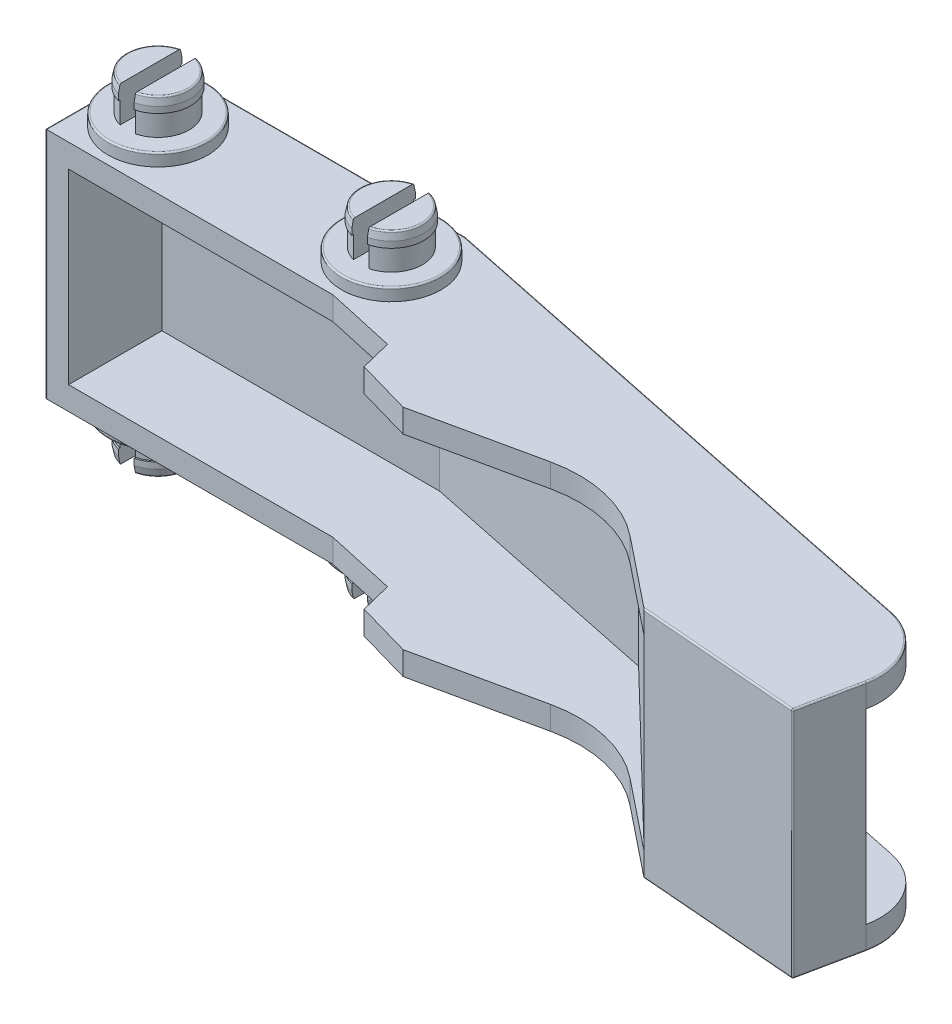
from build123d import *

# Parameters (mm, degrees)
EXTRUDE_1_DEPTH        = 15
FILLET_1_R             = 4
FILLET_2_R             = 8
CUT_EXTRUDE_1_DEPTH    = 13.5
EXTRUDE_2_DEPTH        = 1.5
SKETCH_3_R             = 3.2
EXTRUDE_3_DEPTH        = 0.8
SKETCH_4_R             = 2
EXTRUDE_4_DEPTH        = 2.3
SKETCH_6_W             = 1
SKETCH_6_H             = 6
CUT_EXTRUDE_2_DEPTH    = 2.3
FILLET_3_R             = 0.1
FILLET_3_OF_MIRROR_1_R = 0.1
FILLET_5_R             = 0.1
EXTRUDE_5_DEPTH        = 12


# Read off the part's stored shape, not the designer's step: 镜向2
with BuildPart() as part:
    # 草图1 → 凸台-拉伸1 (new body)
    with BuildSketch(Plane(origin=(0, 0, 0), x_dir=(1, 0, 0), z_dir=(0, 1, 0))):
        Polygon((0, 0), (0, 3.75), (19.5, 3.75), (58, -4.25), (56.372428345, -12.082688588), (46, -11.25), (38.5, -5.25), (27, -7.75), (23.5, -6.75), (23, -4.75), (18.5, -3.75), (0, -3.75), align=None)
    extrude(amount=EXTRUDE_1_DEPTH)

    # 圆角1
    fillet_1_edges = [part.edges().sort_by_distance(p)[0] for p in [
        (58, 7.5, 4.25),
    ]]
    fillet(fillet_1_edges, radius=FILLET_1_R)

    # 圆角2
    fillet_2_edges = [part.edges().sort_by_distance(p)[0] for p in [
        (38.5, 7.5, 5.25),
    ]]
    fillet(fillet_2_edges, radius=FILLET_2_R)

    # 草图2 → 切除-拉伸1 (cut)
    with BuildSketch(Plane(origin=(0, 15, 0), x_dir=(1, 0, 0), z_dir=(0, 1, 0))):
        with BuildLine():
            Line((54.083655706, -3.436214173), (36.230804378, 0.27346922))
            Line((36.230804378, 0.27346922), (46.655708254, -9.797813849))
            Line((46.655708254, -9.797813849), (56.679988889, -10.602553472))
            Line((56.679988889, -10.602553472), (57.186214173, -8.166344294))
            ThreePointArc((57.186214173, -8.166344294), (56.614576963, -5.158718336), (54.083655706, -3.436214173))
        make_face()
        with BuildLine():
            Line((19.345802722, 2.25), (1.5, 2.25))
            Line((1.5, 2.25), (1.5, -3.75))
            Line((1.5, -3.75), (18.5, -3.75))
            Line((18.5, -3.75), (23, -4.75))
            Line((23, -4.75), (23.5, -6.75))
            Line((23.5, -6.75), (27, -7.75))
            Line((27, -7.75), (34.777599803, -6.059217434))
            ThreePointArc((34.777599803, -6.059217434), (38.30350642, -6.087917971), (41.474597338, -7.62967787))
            Line((41.474597338, -7.62967787), (46, -11.25))
            Line((46, -11.25), (35.500722934, -1.106866538))
            Line((35.500722934, -1.106866538), (19.345802722, 2.25))
        make_face()
    extrude(amount=-CUT_EXTRUDE_1_DEPTH, mode=Mode.SUBTRACT)

    # 草图2<2> → 凸台-拉伸2 (add)
    with BuildSketch(Plane(origin=(0, 15, 0), x_dir=(1, 0, 0), z_dir=(0, 1, 0))):
        with BuildLine():
            Line((54.083655706, -3.436214173), (36.230804378, 0.27346922))
            Line((36.230804378, 0.27346922), (46.655708254, -9.797813849))
            Line((46.655708254, -9.797813849), (56.679988889, -10.602553472))
            Line((56.679988889, -10.602553472), (57.186214173, -8.166344294))
            ThreePointArc((57.186214173, -8.166344294), (56.614576963, -5.158718336), (54.083655706, -3.436214173))
        make_face()
        with BuildLine():
            Line((19.345802722, 2.25), (1.5, 2.25))
            Line((1.5, 2.25), (1.5, -3.75))
            Line((1.5, -3.75), (18.5, -3.75))
            Line((18.5, -3.75), (23, -4.75))
            Line((23, -4.75), (23.5, -6.75))
            Line((23.5, -6.75), (27, -7.75))
            Line((27, -7.75), (34.777599803, -6.059217434))
            ThreePointArc((34.777599803, -6.059217434), (38.30350642, -6.087917971), (41.474597338, -7.62967787))
            Line((41.474597338, -7.62967787), (46, -11.25))
            Line((46, -11.25), (35.500722934, -1.106866538))
            Line((35.500722934, -1.106866538), (19.345802722, 2.25))
        make_face()
    extrude(amount=-EXTRUDE_2_DEPTH)

    # 草图3 → 凸台-拉伸3 (add)
    with BuildSketch(Plane(origin=(0, 15, 0), x_dir=(1, 0, 0), z_dir=(0, 1, 0))):
        with Locations(Location((3.5, 0, 0), (0, 0, 270))):
            Circle(SKETCH_3_R)
    extrude_3 = extrude(amount=EXTRUDE_3_DEPTH)

    # 草图4 → 凸台-拉伸4 (add)
    with BuildSketch(Plane(origin=(0, 15.8, 0), x_dir=(1, 0, 0), z_dir=(0, 1, 0))):
        with Locations(Location((3.5, 0, 0), (0, 0, 270))):
            Circle(SKETCH_4_R)
    extrude_4 = extrude(amount=EXTRUDE_4_DEPTH)

    # 草图5 → 旋转1 (revolve)
    with BuildSketch(Plane.XY):
        Polygon((1.5, 18.1), (1.5, 17.2), (1.4, 17.2), (1.4, 17.6), align=None)
    revolve_1 = revolve(axis=Axis((3.5, 18.1, 0), (0, -1, 0)))

    # 草图6 → 切除-拉伸2 (cut)
    with BuildSketch(Plane(origin=(0, 18.1, 0), x_dir=(1, 0, 0), z_dir=(0, 1, 0))):
        with Locations((3.5, 0)):
            Rectangle(SKETCH_6_W, SKETCH_6_H)
    cut_extrude_2 = extrude(amount=-CUT_EXTRUDE_2_DEPTH, mode=Mode.SUBTRACT)

    # 圆角3
    fillet_3_edges = [part.edges().sort_by_distance(p)[0] for p in [
        (3.5, 15.8, -3.2),
        (5.5, 18.1, 0),
        (1.5, 18.1, 0),
    ]]
    fillet(fillet_3_edges, radius=FILLET_3_R)

    # 镜向1: 凸台-拉伸3, 凸台-拉伸4, 旋转1, 切除-拉伸2 across plane
    add(extrude_3.mirror(Plane.ZY.offset(-11)))
    add(extrude_4.mirror(Plane.ZY.offset(-11)))
    add(revolve_1.mirror(Plane.ZY.offset(-11)))
    add(cut_extrude_2.mirror(Plane.ZY.offset(-11)), mode=Mode.SUBTRACT)

    # 圆角3 of 镜向1
    fillet_3_of_mirror_1_edges = [part.edges().sort_by_distance(p)[0] for p in [
        (18.5, 15.8, -3.2),
        (16.5, 18.1, 0),
        (20.5, 18.1, 0),
    ]]
    fillet(fillet_3_of_mirror_1_edges, radius=FILLET_3_OF_MIRROR_1_R)

    # 镜向2: part across plane


with BuildPart() as part_1:
    add(part.part)
    add(part.part.mirror(Plane.ZX.offset(7.5)))

    # 圆角5
    fillet_5_edges = [part_1.edges().sort_by_distance(p)[0] for p in [
        (0, 0, 0),
        (9.75, 0, -3.75),
        (56.779321259, 0, 10.124516441),
        (51.186214173, 0, 11.666344294),
        (56.614576963, 15, 5.158718336),
        (0, 7.5, -3.75),
        (56.372428345, 7.5, 12.082688588),
        (0, 7.5, 3.75),
        (51.186214173, 15, 11.666344294),
        (56.779321259, 15, 10.124516441),
        (36.791827853, 0, -0.156892914),
        (9.75, 15, -3.75),
        (56.614576963, 0, 5.158718336),
        (0, 15, 0),
        (36.791827853, 15, -0.156892914),
    ]]
    fillet(fillet_5_edges, radius=FILLET_5_R)

    # 草图8 → 凸台-拉伸5 (add)
    with BuildSketch(Plane(origin=(0, 1.5, 0), x_dir=(1, 0, 0), z_dir=(0, 1, 0))):
        Polygon((56.679988889, -10.602553472), (57.186214173, -8.166344294), (55.717585063, -7.861174609), (55.173085099, -10.481580683), align=None)
    extrude(amount=EXTRUDE_5_DEPTH)


solid = part_1.part
